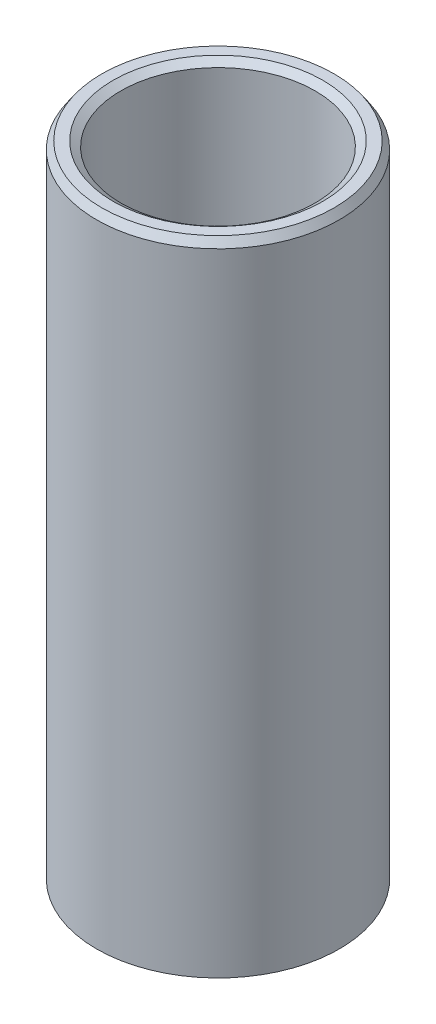
from build123d import *
from OCP.BRepFilletAPI import BRepFilletAPI_MakeChamfer

# Parameters (mm, degrees)
SKETCH1_R           = 55
BOSS_EXTRUDE1_DEPTH = 291.932881894
SKETCH2_R           = 44.027386716
CUT_EXTRUDE1_DEPTH  = 303.117208267
CHAMFER1_SIZE       = 3.493866792
CHAMFER1_SIZE2      = 2.393388905


with BuildPart() as part:
    # Sketch1 → Boss-Extrude1 (new body)
    with BuildSketch(Plane(origin=(0, 0, 0), x_dir=(1, 0, 0), z_dir=(0, 1, 0))):
        Circle(SKETCH1_R)
    extrude(amount=BOSS_EXTRUDE1_DEPTH)

    # Sketch2 → Cut-Extrude1 (cut, through all)
    with BuildSketch(Plane(origin=(0, 0, 0), x_dir=(1, 0, 0), z_dir=(0, 1, 0))):
        Circle(SKETCH2_R)
    extrude(amount=CUT_EXTRUDE1_DEPTH, mode=Mode.SUBTRACT)

    # Chamfer1: one chamfer whose edges measure the first distance from different faces: ONE call of the kernel's chamfer builder (chamfer() names one face for all edges)
    chamfer1_edges_1 = [part.edges().sort_by_distance(p)[0] for p in [
        (-44.027386716, 291.932881894, 0),
    ]]
    chamfer1_side_1 = [part.faces().sort_by_distance(p)[0] for p in [
        (-53.444365081, 291.932881894, 0),
    ]]
    chamfer1_edges_2 = [part.edges().sort_by_distance(p)[0] for p in [
        (-44.027386716, 0, 0),
    ]]
    chamfer1_side_2 = [part.faces().sort_by_distance(p)[0] for p in [
        (-44.027386716, 145.966440947, 0),
    ]]
    chamfer1_edges_3 = [part.edges().sort_by_distance(p)[0] for p in [
        (-55, 0, 0),
    ]]
    chamfer1_side_3 = [part.faces().sort_by_distance(p)[0] for p in [
        (-53.444365081, 0, 0),
    ]]
    chamfer1_edges_4 = [part.edges().sort_by_distance(p)[0] for p in [
        (-55, 291.932881894, 0),
    ]]
    chamfer1_side_4 = [part.faces().sort_by_distance(p)[0] for p in [
        (-55, 145.966440947, 0),
    ]]
    chamfer1 = BRepFilletAPI_MakeChamfer(part.part.solid().wrapped)
    for e in chamfer1_edges_1:
        chamfer1.Add(CHAMFER1_SIZE, CHAMFER1_SIZE2, e.wrapped, chamfer1_side_1[0].wrapped)  # the first distance lies on this face
    for e in chamfer1_edges_2:
        chamfer1.Add(CHAMFER1_SIZE, CHAMFER1_SIZE2, e.wrapped, chamfer1_side_2[0].wrapped)  # the first distance lies on this face
    for e in chamfer1_edges_3:
        chamfer1.Add(CHAMFER1_SIZE, CHAMFER1_SIZE2, e.wrapped, chamfer1_side_3[0].wrapped)  # the first distance lies on this face
    for e in chamfer1_edges_4:
        chamfer1.Add(CHAMFER1_SIZE, CHAMFER1_SIZE2, e.wrapped, chamfer1_side_4[0].wrapped)  # the first distance lies on this face
    add(Compound.cast(chamfer1.Shape()), mode=Mode.REPLACE)


solid = part.part
